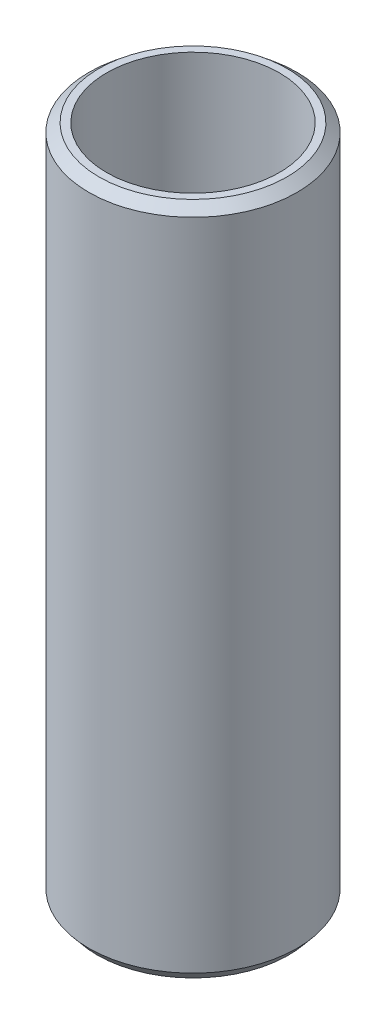
from build123d import *
from OCP.BRepFilletAPI import BRepFilletAPI_MakeChamfer

# Parameters (mm, degrees)
SKETCH1_R           = 50
BOSS_EXTRUDE1_DEPTH = 323.355413504
SKETCH2_R           = 41.518281251
CUT_EXTRUDE1_DEPTH  = 331.996561073
CHAMFER1_SIZE       = 4.020650666
CHAMFER1_SIZE2      = 4.835499132


with BuildPart() as part:
    # Sketch1 → Boss-Extrude1 (new body)
    with BuildSketch(Plane(origin=(0, 0, 0), x_dir=(1, 0, 0), z_dir=(0, 1, 0))):
        Circle(SKETCH1_R)
    extrude(amount=BOSS_EXTRUDE1_DEPTH)

    # Sketch2 → Cut-Extrude1 (cut, through all)
    with BuildSketch(Plane(origin=(0, 0, 0), x_dir=(1, 0, 0), z_dir=(0, 1, 0))):
        Circle(SKETCH2_R)
    extrude(amount=CUT_EXTRUDE1_DEPTH, mode=Mode.SUBTRACT)

    # Chamfer1: one chamfer whose edges measure the first distance from different faces: ONE call of the kernel's chamfer builder (chamfer() names one face for all edges)
    chamfer1_edges_1 = [part.edges().sort_by_distance(p)[0] for p in [
        (-50, 323.355413504, 0),
    ]]
    chamfer1_side_1 = [part.faces().sort_by_distance(p)[0] for p in [
        (-50, 161.677706752, 0),
    ]]
    chamfer1_edges_2 = [part.edges().sort_by_distance(p)[0] for p in [
        (-50, 0, 0),
    ]]
    chamfer1_side_2 = [part.faces().sort_by_distance(p)[0] for p in [
        (-48.585786438, 0, 0),
    ]]
    chamfer1 = BRepFilletAPI_MakeChamfer(part.part.solid().wrapped)
    for e in chamfer1_edges_1:
        chamfer1.Add(CHAMFER1_SIZE, CHAMFER1_SIZE2, e.wrapped, chamfer1_side_1[0].wrapped)  # the first distance lies on this face
    for e in chamfer1_edges_2:
        chamfer1.Add(CHAMFER1_SIZE, CHAMFER1_SIZE2, e.wrapped, chamfer1_side_2[0].wrapped)  # the first distance lies on this face
    add(Compound.cast(chamfer1.Shape()), mode=Mode.REPLACE)


solid = part.part
